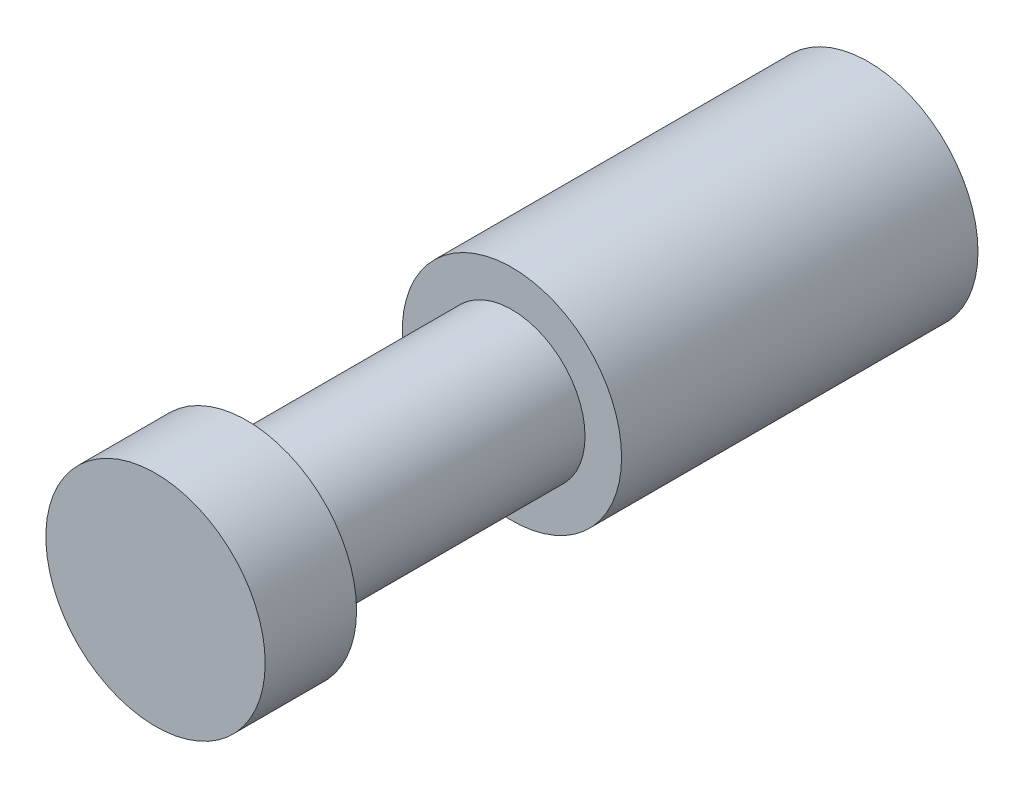
from build123d import *

# Parameters (mm, degrees)
SKETCH1_R           = 6
SKETCH1_R_2         = 4.2
BOSS_EXTRUDE1_DEPTH = 12
SKETCH2_R           = 6
BOSS_EXTRUDE2_DEPTH = 2
SKETCH3_R           = 4
BOSS_EXTRUDE3_DEPTH = 20
SKETCH4_R           = 6
BOSS_EXTRUDE4_DEPTH = 5
SKETCH5_R           = 6
BOSS_EXTRUDE5_DEPTH = 5.5


with BuildPart() as part:
    # Sketch1 → Boss-Extrude1 (new body)
    with BuildSketch(Plane.XY):
        Circle(SKETCH1_R)
        Circle(SKETCH1_R_2, mode=Mode.SUBTRACT)
    extrude(amount=BOSS_EXTRUDE1_DEPTH)

    # Sketch2 → Boss-Extrude2 (add)
    with BuildSketch(Plane.XY.offset(12)):
        Circle(SKETCH2_R)
    extrude(amount=BOSS_EXTRUDE2_DEPTH)

    # Sketch3 → Boss-Extrude3 (add)
    with BuildSketch(Plane.XY.offset(14)):
        Circle(SKETCH3_R)
    extrude(amount=BOSS_EXTRUDE3_DEPTH)

    # Sketch4 → Boss-Extrude4 (add)
    with BuildSketch(Plane.XY.offset(34)):
        Circle(SKETCH4_R)
    extrude(amount=BOSS_EXTRUDE4_DEPTH)

    # Sketch5 → Boss-Extrude5 (add)
    with BuildSketch(Plane.XY.offset(14)):
        Circle(SKETCH5_R)
    extrude(amount=BOSS_EXTRUDE5_DEPTH)


solid = part.part
